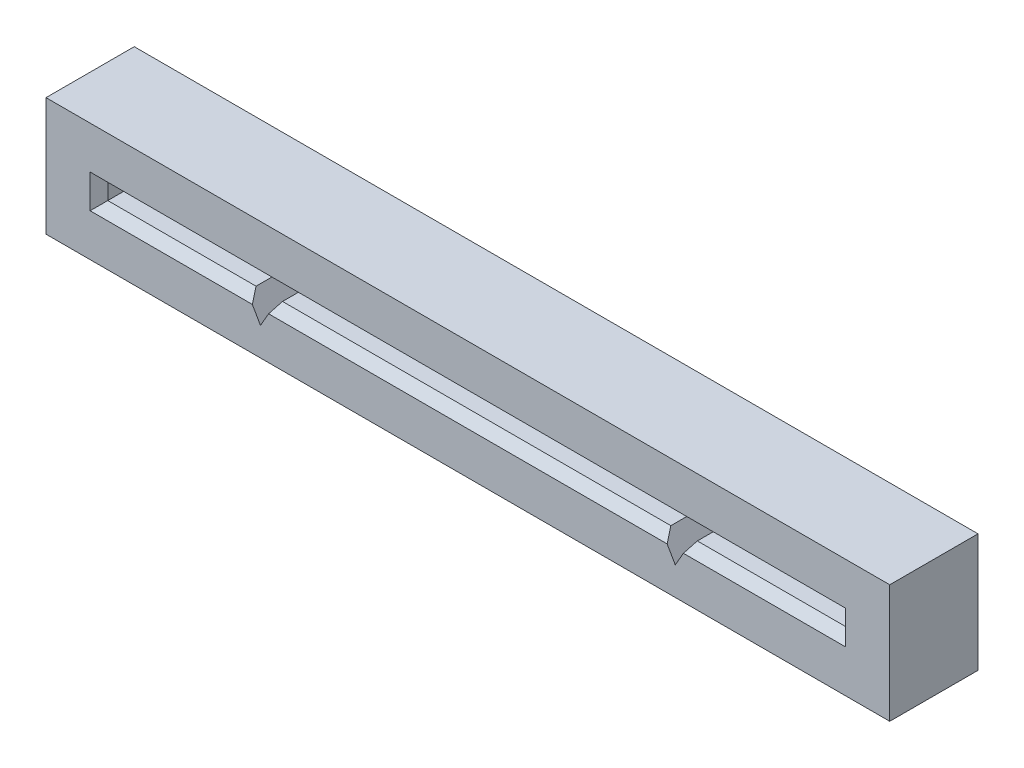
from build123d import *

# Parameters (mm, degrees)
SKETCH_1_W               = 47.8
SKETCH_1_H               = 6.7
EXTRUDE_1_DEPTH          = 5
CUT_EXTRUDE_1_DEPTH      = 75.234883605
CUT_EXTRUDE_1_DEPTH_BACK = 75.234883605
CHAMFER_1_SIZE           = 0.5


with BuildPart() as part:
    # Эскиз1 → Бобышка-Вытянуть1 (new body)
    with BuildSketch(Plane(origin=(0, 66.754264805, 0), x_dir=(-1, 0, 0), z_dir=(0, 0, 1))):
        with Locations((0, 66.754264805)):
            Rectangle(SKETCH_1_W, SKETCH_1_H)
    extrude(amount=EXTRUDE_1_DEPTH)

    # Эскиз2 → Вырез-Вытянуть1 (cut, two sides: drawn at the far end of the back side and taken through both)
    with BuildSketch(Plane(origin=(0, 66.754264805, 5), x_dir=(-1, 0, 0), z_dir=(0, 0, 1)).offset(-CUT_EXTRUDE_1_DEPTH_BACK)):
        Polygon((-20.9, 67.204264805), (-20.9, 66.304264805), (20.9, 66.304264805), (20.9, 67.204264805), (12.5, 67.204264805), (11.75, 68.504264805), (11, 67.204264805), (-11, 67.204264805), (-11.75, 68.504264805), (-12.5, 67.204264805), align=None)
    extrude(amount=CUT_EXTRUDE_1_DEPTH + CUT_EXTRUDE_1_DEPTH_BACK, mode=Mode.SUBTRACT)

    # Фаска1
    chamfer_1_edges = [part.edges().sort_by_distance(p)[0] for p in [
        (16.7, -0.45, 5),
        (20.9, 0, 5),
        (0, 0.45, 5),
        (-20.9, 0, 5),
        (-16.7, -0.45, 5),
        (0, -0.45, 5),
    ]]
    chamfer(chamfer_1_edges, length=CHAMFER_1_SIZE)


solid = part.part
